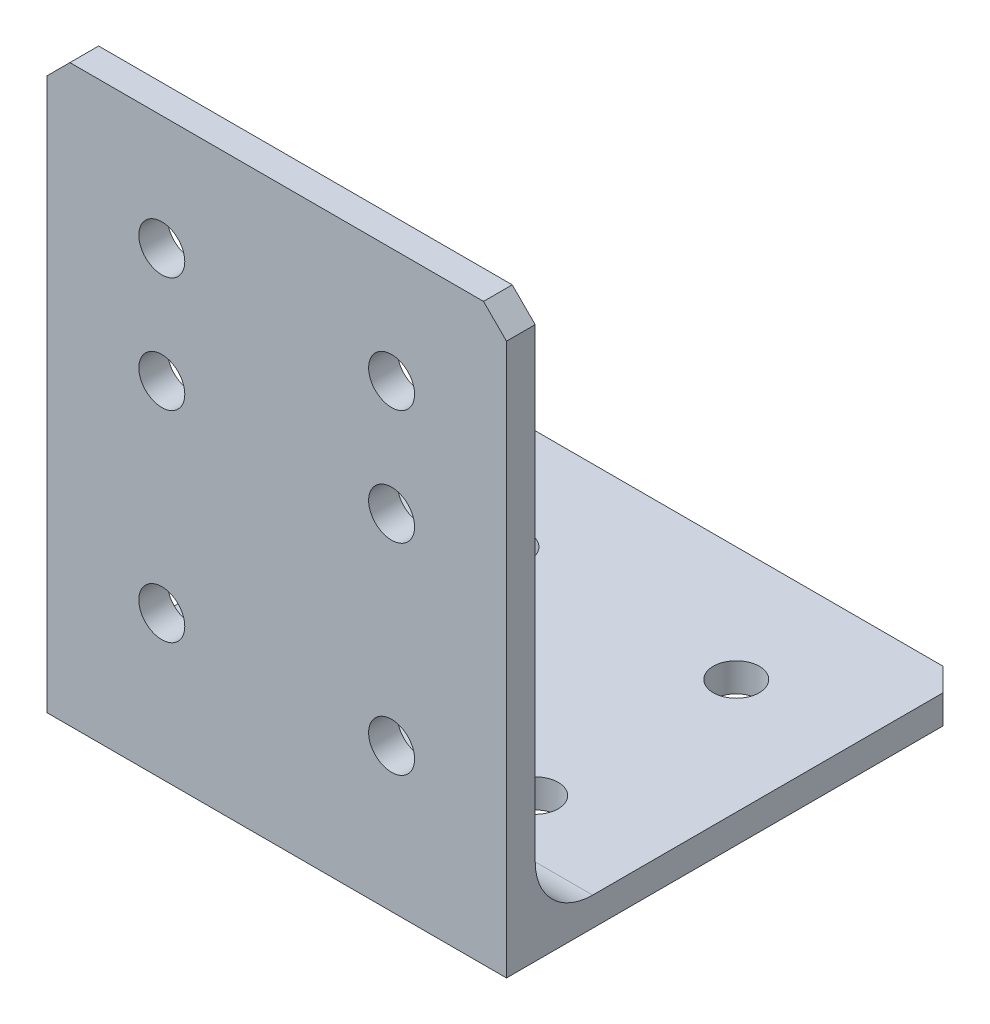
from build123d import *

# Parameters (mm, degrees)
BOSS_EXTRUDE1_DEPTH = 50.8
SKETCH2_R           = 2.54
CUT_EXTRUDE1_DEPTH  = 96.882897328
SKETCH3_R           = 2.54
CUT_EXTRUDE2_DEPTH  = 96.882897328
FILLET1_R           = 6.35
CHAMFER1_SIZE       = 2.54


with BuildPart() as part:
    # Sketch1 → Boss-Extrude1 (new body)
    with BuildSketch(Plane(origin=(0, 0, 0), x_dir=(0, 0, -1), z_dir=(1, 0, 0))):
        Polygon((0, 0), (0, 63.5), (3.175, 63.5), (3.175, 3.175), (50.8, 3.175), (50.8, 0), align=None)
    extrude(amount=BOSS_EXTRUDE1_DEPTH)

    # Sketch2 → Cut-Extrude1 (cut, through all)
    with BuildSketch(Plane.XY):
        with Locations((12.7, 38.1)):
            Circle(SKETCH2_R)
        with Locations((12.7, 15.875)):
            Circle(SKETCH2_R)
        with Locations((12.7, 50.8)):
            Circle(SKETCH2_R)
        with Locations((38.1, 50.8)):
            Circle(SKETCH2_R)
        with Locations((38.1, 15.875)):
            Circle(SKETCH2_R)
        with Locations((38.1, 38.1)):
            Circle(SKETCH2_R)
    extrude(amount=-CUT_EXTRUDE1_DEPTH, mode=Mode.SUBTRACT)

    # Sketch3 → Cut-Extrude2 (cut, through all)
    with BuildSketch(Plane.XZ):
        with Locations((38.1, -38.1)):
            Circle(SKETCH3_R)
        with Locations((38.1, -15.875)):
            Circle(SKETCH3_R)
        with Locations((12.7, -38.1)):
            Circle(SKETCH3_R)
        with Locations((12.7, -15.875)):
            Circle(SKETCH3_R)
    extrude(amount=-CUT_EXTRUDE2_DEPTH, mode=Mode.SUBTRACT)

    # Fillet1
    fillet1_edges = [part.edges().sort_by_distance(p)[0] for p in [
        (25.4, 3.175, -3.175),
    ]]
    fillet(fillet1_edges, radius=FILLET1_R)

    # Chamfer1
    chamfer1_edges = [part.edges().sort_by_distance(p)[0] for p in [
        (50.8, 63.5, -1.5875),
        (0, 63.5, -1.5875),
        (50.8, 1.5875, -50.8),
        (0, 1.5875, -50.8),
    ]]
    chamfer(chamfer1_edges, length=CHAMFER1_SIZE)


solid = part.part
